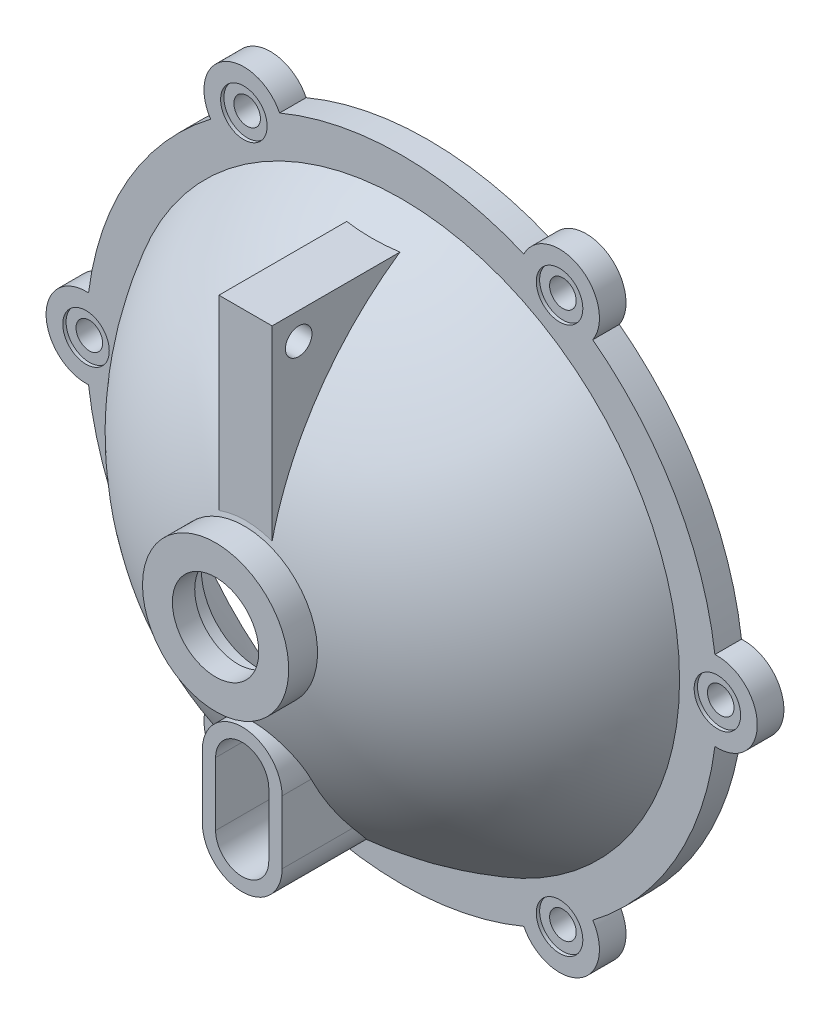
from build123d import *

# Parameters (mm, degrees)
SKETCH_2_R                   = 12
EXTRUDE_1_DEPTH              = 8
HOLE_WIZARD_M8_3_D           = 8
HOLE_WIZARD_M8_3_CBORE_D     = 14
HOLE_WIZARD_M8_3_CBORE_DEPTH = 1
PATTERN_CIRCULAR_1_COUNT     = 6
EXTRUDE_2_REACH              = 155.655
EXTRUDE_2_END_RADIUS         = 95
CUT_EXTRUDE_1_DEPTH          = 154.655458738
RIB_START                    = -8
RIB_1_DEPTH                  = 16
CUT_EXTRUDE_3_DEPTH          = 176.197296411
CUT_EXTRUDE_3_DEPTH_BACK     = 176.197296411
SKETCH_14_R                  = 4


with BuildPart() as part:
    # 草图1 → 旋转1 (revolve)
    with BuildSketch(Plane(origin=(0, 0, 0), x_dir=(0, 0, -1), z_dir=(1, 0, 0)), mode=Mode.PRIVATE) as revolve_1_sk:
        with BuildLine():
            Line((-88.37986196, 17), (-94.37986196, 17))
            Line((-94.37986196, 17), (-94.37986196, 13))
            Line((-94.37986196, 13), (-101.094473982, 13))
            Line((-101.094473982, 13), (-101.094473982, 22))
            Line((-101.094473982, 22), (-92.417530804, 22))
            ThreePointArc((-92.417530804, 22), (-75.342508858, 57.866279982), (-45.094473982, 83.61512074))
            Line((-45.094473982, 83.61512074), (-45.094473982, 95))
            Line((-45.094473982, 95), (-37.094473982, 95))
            Line((-37.094473982, 95), (-37.094473982, 82))
            ThreePointArc((-37.094473982, 82), (-70.65551815, 55.747625555), (-88.37986196, 17))
        make_face()
    revolve(revolve_1_sk.sketch.rotate(Axis((0, 0, 0), (0, 0, 1)), 90), axis=Axis((0, 0, 0), (0, 0, 1)))

    # 草图2 → 凸台-拉伸1 (add)
    with BuildSketch(Plane(origin=(0, 0, 37.094473982), x_dir=(-1, 0, 0), z_dir=(0, 0, -1))):
        with Locations((95, 0)):
            Circle(SKETCH_2_R)
    extrude_1 = extrude(amount=-EXTRUDE_1_DEPTH)

    # M8 六角头螺栓的柱形沉头孔3 (through all)
    with Locations(Plane.XY.offset(45.094473982)):
        with Locations((-95, 0)):
            hole_wizard_m8_3 = CounterBoreHole(HOLE_WIZARD_M8_3_D / 2, HOLE_WIZARD_M8_3_CBORE_D / 2, HOLE_WIZARD_M8_3_CBORE_DEPTH)

    # 阵列(圆周)1: 凸台-拉伸1, M8 六角头螺栓的柱形沉头孔3 ×6 about axis
    pattern_circular_1_axis = Axis((0, 0, 0), (0, 0, 1))
    add([extrude_1.rotate(pattern_circular_1_axis, i * 360 / PATTERN_CIRCULAR_1_COUNT) for i in range(1, PATTERN_CIRCULAR_1_COUNT)])
    add([hole_wizard_m8_3.rotate(pattern_circular_1_axis, i * 360 / PATTERN_CIRCULAR_1_COUNT) for i in range(1, PATTERN_CIRCULAR_1_COUNT)], mode=Mode.SUBTRACT)

    # 凸台-拉伸2: up to this sphere (the profile starts outside it)
    extrude_2_end = Location((0, 0, 0)) * Sphere(EXTRUDE_2_END_RADIUS, mode=Mode.PRIVATE)
    # 草图9 → 凸台-拉伸2 (add, up to the surface)
    with BuildSketch(Plane(origin=(0, 0, 93.094473982), x_dir=(-1, 0, 0), z_dir=(0, 0, -1)), mode=Mode.PRIVATE) as extrude_2_sk1:
        with BuildLine():
            Line((-12, -42), (-12, -61))
            ThreePointArc((-12, -61), (0, -73), (12, -61))
            Line((12, -61), (12, -42))
            ThreePointArc((12, -42), (0, -30), (-12, -42))
        make_face()
    extrude_2_tool1 = extrude(extrude_2_sk1.sketch, amount=EXTRUDE_2_REACH, mode=Mode.PRIVATE) - extrude_2_end
    add(extrude_2_tool1.solids().sort_by_distance((0, -51.5, 93.094474))[0])

    # 草图10 → 切除-拉伸1 (cut, through all)
    with BuildSketch(Plane.XY.offset(93.094473982)):
        with BuildLine():
            Line((-8, -42), (-8, -61))
            ThreePointArc((-8, -61), (0, -69), (8, -61))
            Line((8, -61), (8, -42))
            ThreePointArc((8, -42), (0, -34), (-8, -42))
        make_face()
    extrude(amount=-CUT_EXTRUDE_1_DEPTH, mode=Mode.SUBTRACT)

    # 筋1: read off the stored shape, not the designer's step
    # 筋1 outline → 筋1 (add)
    with BuildSketch(Plane(origin=(0, 0, 0), x_dir=(0, 0, -1), z_dir=(1, 0, 0)).offset(RIB_START)):
        with BuildLine():
            Line((-53.637673328, 78), (-92.094473982, 78))
            Line((-92.094473982, 78), (-92.094473982, 21.899951187))
            ThreePointArc((-92.094473982, 21.899951187), (-78.078605002, 53.523186012), (-53.637673328, 78))
        make_face()
    extrude(amount=RIB_1_DEPTH)

    # 草图14 → 切除-拉伸3 (cut, two sides: drawn at the far end of the back side and taken through both)
    with BuildSketch(Plane(origin=(0, 0, 0), x_dir=(0, 0, -1), z_dir=(1, 0, 0)).offset(-CUT_EXTRUDE_3_DEPTH_BACK)):
        with Locations((-84.094473982, 70)):
            Circle(SKETCH_14_R)
    extrude(amount=CUT_EXTRUDE_3_DEPTH + CUT_EXTRUDE_3_DEPTH_BACK, mode=Mode.SUBTRACT)


solid = part.part
